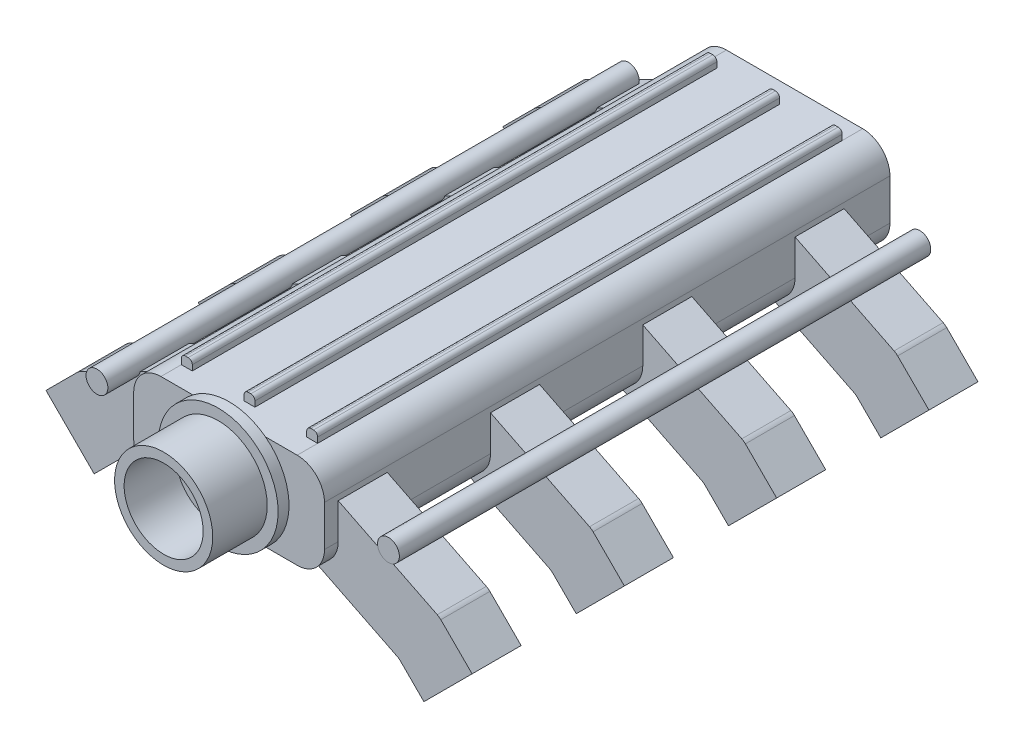
from build123d import *

# Parameters (mm, degrees)
PLENUM_START          = -375
PLENUM_DEPTH          = 415
PLENUM_START_2        = -360
PLENUM_RIBS_DEPTH     = 385
RUNNER_START          = -6.1
RUNNER_1_DEPTH        = 36
RUNNER_START_2        = -29.9
RUNNER_2_DEPTH        = 36
RUNNER_START_3        = -117.86
RUNNER_3_DEPTH        = 36
RUNNER_START_4        = -141.66
RUNNER_4_DEPTH        = 36
RUNNER_START_5        = -229.62
RUNNER_5_DEPTH        = 36
RUNNER_START_6        = -253.42
RUNNER_6_DEPTH        = 36
RUNNER_START_7        = -341.38
RUNNER_7_DEPTH        = 36
RUNNER_START_8        = -365.18
RUNNER_8_DEPTH        = 36
THROTTLE_START        = 40
SKETCH11_R            = 44
THROTTLE_FLANGE_DEPTH = 8
THROTTLE_START_2      = 48
SKETCH12_R            = 36
THROTTLE_BODY_DEPTH   = 40
THROTTLE_START_3      = 50
SKETCH13_R            = 29
THROTTLE_BORE_DEPTH   = 40
FUEL_START            = -360
SKETCH14_R            = 8
FUEL_RAILS_DEPTH      = 390


with BuildPart() as part:
    # Sketch1 → Plenum (new body)
    with BuildSketch(Plane.XY.offset(PLENUM_START)):
        with BuildLine():
            Line((-50, 285), (50, 285))
            ThreePointArc((50, 285), (64.142135624, 290.857864376), (70, 305))
            Line((70, 305), (70, 335))
            ThreePointArc((70, 335), (64.142135624, 349.142135624), (50, 355))
            Line((50, 355), (-50, 355))
            ThreePointArc((-50, 355), (-64.142135624, 349.142135624), (-70, 335))
            Line((-70, 335), (-70, 305))
            ThreePointArc((-70, 305), (-64.142135624, 290.857864376), (-50, 285))
        make_face()
    extrude(amount=PLENUM_DEPTH)

    # Sketch2 → Plenum Ribs (add)
    with BuildSketch(Plane.XY.offset(PLENUM_START_2)):
        with BuildLine():
            Line((-50, 350), (-42, 350))
            Line((-42, 350), (-42, 359))
            ThreePointArc((-42, 359), (-42.878679656, 361.121320344), (-45, 362))
            Line((-45, 362), (-47, 362))
            ThreePointArc((-47, 362), (-49.121320344, 361.121320344), (-50, 359))
            Line((-50, 359), (-50, 350))
        make_face()
        with BuildLine():
            Line((-4, 350), (4, 350))
            Line((4, 350), (4, 359))
            ThreePointArc((4, 359), (3.121320344, 361.121320344), (1, 362))
            Line((1, 362), (-1, 362))
            ThreePointArc((-1, 362), (-3.121320344, 361.121320344), (-4, 359))
            Line((-4, 359), (-4, 350))
        make_face()
        with BuildLine():
            Line((42, 350), (50, 350))
            Line((50, 350), (50, 359))
            ThreePointArc((50, 359), (49.121320344, 361.121320344), (47, 362))
            Line((47, 362), (45, 362))
            ThreePointArc((45, 362), (42.878679656, 361.121320344), (42, 359))
            Line((42, 359), (42, 350))
        make_face()
    extrude(amount=PLENUM_RIBS_DEPTH)

    # Sketch3 → Runner 1 (add)
    with BuildSketch(Plane.XY.offset(RUNNER_START)):
        with BuildLine():
            Line((132.900719524, 234.724096015), (115.737566336, 251.887249203))
            ThreePointArc((115.737566336, 251.887249203), (114.502776925, 252.936394099), (113.114761283, 253.772350127))
            Line((113.114761283, 253.772350127), (28.879343102, 295.60957816))
            Line((28.879343102, 295.60957816), (51.120656898, 340.39042184))
            Line((51.120656898, 340.39042184), (142.684314275, 294.913475254))
            ThreePointArc((142.684314275, 294.913475254), (144.072329917, 294.077519226), (145.307119327, 293.02837433))
            Line((145.307119327, 293.02837433), (168.256058583, 270.079435074))
            Line((168.256058583, 270.079435074), (132.900719524, 234.724096015))
        make_face()
    extrude(amount=RUNNER_1_DEPTH)

    # Sketch4 → Runner 2 (add)
    with BuildSketch(Plane.XY.offset(RUNNER_START_2)):
        with BuildLine():
            Line((-168.256058583, 270.079435074), (-145.307119327, 293.02837433))
            ThreePointArc((-145.307119327, 293.02837433), (-144.072329917, 294.077519226), (-142.684314275, 294.913475254))
            Line((-142.684314275, 294.913475254), (-51.120656898, 340.39042184))
            Line((-51.120656898, 340.39042184), (-28.879343102, 295.60957816))
            Line((-28.879343102, 295.60957816), (-113.114761283, 253.772350127))
            ThreePointArc((-113.114761283, 253.772350127), (-114.502776925, 252.936394099), (-115.737566336, 251.887249203))
            Line((-115.737566336, 251.887249203), (-132.900719524, 234.724096015))
            Line((-132.900719524, 234.724096015), (-168.256058583, 270.079435074))
        make_face()
    extrude(amount=RUNNER_2_DEPTH)

    # Sketch5 → Runner 3 (add)
    with BuildSketch(Plane.XY.offset(RUNNER_START_3)):
        with BuildLine():
            Line((132.900719524, 234.724096015), (115.737566336, 251.887249203))
            ThreePointArc((115.737566336, 251.887249203), (114.502776925, 252.936394099), (113.114761283, 253.772350127))
            Line((113.114761283, 253.772350127), (28.879343102, 295.60957816))
            Line((28.879343102, 295.60957816), (51.120656898, 340.39042184))
            Line((51.120656898, 340.39042184), (142.684314275, 294.913475254))
            ThreePointArc((142.684314275, 294.913475254), (144.072329917, 294.077519226), (145.307119327, 293.02837433))
            Line((145.307119327, 293.02837433), (168.256058583, 270.079435074))
            Line((168.256058583, 270.079435074), (132.900719524, 234.724096015))
        make_face()
    extrude(amount=RUNNER_3_DEPTH)

    # Sketch6 → Runner 4 (add)
    with BuildSketch(Plane.XY.offset(RUNNER_START_4)):
        with BuildLine():
            Line((-168.256058583, 270.079435074), (-145.307119327, 293.02837433))
            ThreePointArc((-145.307119327, 293.02837433), (-144.072329917, 294.077519226), (-142.684314275, 294.913475254))
            Line((-142.684314275, 294.913475254), (-51.120656898, 340.39042184))
            Line((-51.120656898, 340.39042184), (-28.879343102, 295.60957816))
            Line((-28.879343102, 295.60957816), (-113.114761283, 253.772350127))
            ThreePointArc((-113.114761283, 253.772350127), (-114.502776925, 252.936394099), (-115.737566336, 251.887249203))
            Line((-115.737566336, 251.887249203), (-132.900719524, 234.724096015))
            Line((-132.900719524, 234.724096015), (-168.256058583, 270.079435074))
        make_face()
    extrude(amount=RUNNER_4_DEPTH)

    # Sketch7 → Runner 5 (add)
    with BuildSketch(Plane.XY.offset(RUNNER_START_5)):
        with BuildLine():
            Line((132.900719524, 234.724096015), (115.737566336, 251.887249203))
            ThreePointArc((115.737566336, 251.887249203), (114.502776925, 252.936394099), (113.114761283, 253.772350127))
            Line((113.114761283, 253.772350127), (28.879343102, 295.60957816))
            Line((28.879343102, 295.60957816), (51.120656898, 340.39042184))
            Line((51.120656898, 340.39042184), (142.684314275, 294.913475254))
            ThreePointArc((142.684314275, 294.913475254), (144.072329917, 294.077519226), (145.307119327, 293.02837433))
            Line((145.307119327, 293.02837433), (168.256058583, 270.079435074))
            Line((168.256058583, 270.079435074), (132.900719524, 234.724096015))
        make_face()
    extrude(amount=RUNNER_5_DEPTH)

    # Sketch8 → Runner 6 (add)
    with BuildSketch(Plane.XY.offset(RUNNER_START_6)):
        with BuildLine():
            Line((-168.256058583, 270.079435074), (-145.307119327, 293.02837433))
            ThreePointArc((-145.307119327, 293.02837433), (-144.072329917, 294.077519226), (-142.684314275, 294.913475254))
            Line((-142.684314275, 294.913475254), (-51.120656898, 340.39042184))
            Line((-51.120656898, 340.39042184), (-28.879343102, 295.60957816))
            Line((-28.879343102, 295.60957816), (-113.114761283, 253.772350127))
            ThreePointArc((-113.114761283, 253.772350127), (-114.502776925, 252.936394099), (-115.737566336, 251.887249203))
            Line((-115.737566336, 251.887249203), (-132.900719524, 234.724096015))
            Line((-132.900719524, 234.724096015), (-168.256058583, 270.079435074))
        make_face()
    extrude(amount=RUNNER_6_DEPTH)

    # Sketch9 → Runner 7 (add)
    with BuildSketch(Plane.XY.offset(RUNNER_START_7)):
        with BuildLine():
            Line((132.900719524, 234.724096015), (115.737566336, 251.887249203))
            ThreePointArc((115.737566336, 251.887249203), (114.502776925, 252.936394099), (113.114761283, 253.772350127))
            Line((113.114761283, 253.772350127), (28.879343102, 295.60957816))
            Line((28.879343102, 295.60957816), (51.120656898, 340.39042184))
            Line((51.120656898, 340.39042184), (142.684314275, 294.913475254))
            ThreePointArc((142.684314275, 294.913475254), (144.072329917, 294.077519226), (145.307119327, 293.02837433))
            Line((145.307119327, 293.02837433), (168.256058583, 270.079435074))
            Line((168.256058583, 270.079435074), (132.900719524, 234.724096015))
        make_face()
    extrude(amount=RUNNER_7_DEPTH)

    # Sketch10 → Runner 8 (add)
    with BuildSketch(Plane.XY.offset(RUNNER_START_8)):
        with BuildLine():
            Line((-168.256058583, 270.079435074), (-145.307119327, 293.02837433))
            ThreePointArc((-145.307119327, 293.02837433), (-144.072329917, 294.077519226), (-142.684314275, 294.913475254))
            Line((-142.684314275, 294.913475254), (-51.120656898, 340.39042184))
            Line((-51.120656898, 340.39042184), (-28.879343102, 295.60957816))
            Line((-28.879343102, 295.60957816), (-113.114761283, 253.772350127))
            ThreePointArc((-113.114761283, 253.772350127), (-114.502776925, 252.936394099), (-115.737566336, 251.887249203))
            Line((-115.737566336, 251.887249203), (-132.900719524, 234.724096015))
            Line((-132.900719524, 234.724096015), (-168.256058583, 270.079435074))
        make_face()
    extrude(amount=RUNNER_8_DEPTH)

    # Sketch11 → Throttle Flange (add)
    with BuildSketch(Plane.XY.offset(THROTTLE_START)):
        with Locations((0, 320)):
            Circle(SKETCH11_R)
    extrude(amount=THROTTLE_FLANGE_DEPTH)

    # Sketch12 → Throttle Body (add)
    with BuildSketch(Plane.XY.offset(THROTTLE_START_2)):
        with Locations((0, 320)):
            Circle(SKETCH12_R)
    extrude(amount=THROTTLE_BODY_DEPTH)

    # Sketch13 → Throttle Bore (cut)
    with BuildSketch(Plane.XY.offset(THROTTLE_START_3)):
        with Locations((0, 320)):
            Circle(SKETCH13_R)
    extrude(amount=THROTTLE_BORE_DEPTH, mode=Mode.SUBTRACT)

    # Sketch14 → Fuel Rails (add)
    with BuildSketch(Plane.XY.offset(FUEL_START)):
        with Locations((106.963899649, 318.237487596)):
            Circle(SKETCH14_R)
        with Locations((-106.963899649, 318.237487596)):
            Circle(SKETCH14_R)
    extrude(amount=FUEL_RAILS_DEPTH)


solid = part.part
